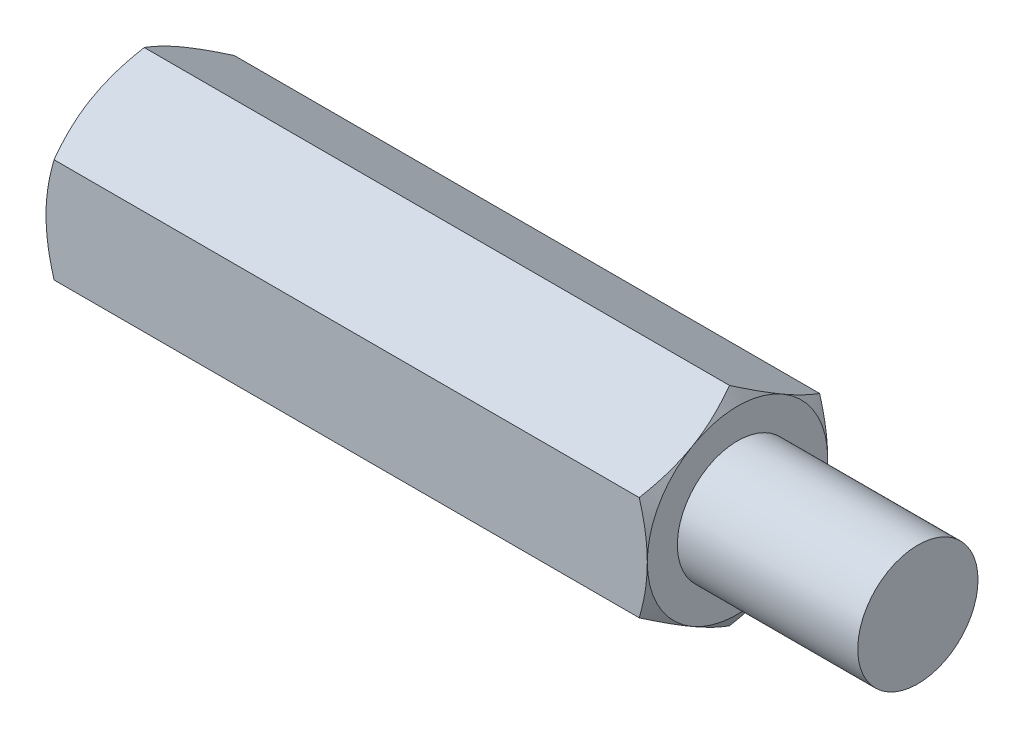
from build123d import *

# Parameters (mm, degrees)
SKETCH2_R          = 2
EXTRUDE1_DEPTH     = 9.5
CHAMFER1_SIZE      = 0.525
EXTRUDE4_DEPTH     = 20
SKETCH8_OUTSIDE_W  = 121.058
SKETCH8_OUTSIDE_H  = 121.986
SKETCH8_OUTSIDE_R  = 3
EXTRUDE5_DEPTH     = 30.853810477
EXTRUDE5_DRAFT     = -60
SKETCH9_OUTSIDE_W  = 88.72
SKETCH9_OUTSIDE_H  = 89.648
SKETCH9_OUTSIDE_R  = 3
EXTRUDE6_DEPTH     = 21.518284529
EXTRUDE6_DRAFT     = -60
EXTRUDE7_START     = -11.1
SKETCH10_R         = 2
EXTRUDE7_DEPTH     = 11.1
SWEEP3_PITCH       = 0.7
SKETCH13_R         = 2.0508
EXTRUDE8_DEPTH     = 30.853810487
SKETCH20_R         = 5
CUT_EXTRUDE6_DEPTH = 3.5


with BuildPart() as part:
    # Sketch2 → Extrude1 (new body)
    with BuildSketch(Plane(origin=(14.75, 0, 0), x_dir=(0, 0, -1), z_dir=(1, 0, 0))):
        Circle(SKETCH2_R)
    extrude(amount=-EXTRUDE1_DEPTH)

    # Chamfer1
    chamfer1_edges = [part.edges().sort_by_distance(p)[0] for p in [
        (14.75, 0, 2),
    ]]
    chamfer(chamfer1_edges, length=CHAMFER1_SIZE)

    # Sketch7 → Extrude4 (add)
    with BuildSketch(Plane(origin=(5.25, 0, 0), x_dir=(0, 0, -1), z_dir=(1, 0, 0))):
        Polygon((0, 3.464101615), (-3, 1.732050808), (-3, -1.732050808), (0, -3.464101615), (3, -1.732050808), (3, 1.732050808), align=None)
    extrude(amount=-EXTRUDE4_DEPTH)


with BuildPart() as extrude5_tool:
    # Sketch8 outside → Extrude5 (with draft: the straight prism first)
    with BuildSketch(Plane.ZY.offset(14.75)):
        Rectangle(SKETCH8_OUTSIDE_W, SKETCH8_OUTSIDE_H)
        Circle(SKETCH8_OUTSIDE_R, mode=Mode.SUBTRACT)
    extrude(amount=-EXTRUDE5_DEPTH)
    # Extrude5: the draft: its side faces are tilted about the plane it starts from
    extrude5_sides = [extrude5_tool.faces().sort_by_distance(p)[0] for p in [
        (0.676905239, -60.993, 0),
        (0.676905239, 0, 60.529),
        (0.676905239, 60.993, 0),
        (0.676905239, 0, -60.529),
        (0.676905239, 0, -3),
    ]]
    draft(extrude5_sides, Plane.ZY.offset(14.75), EXTRUDE5_DRAFT)


with BuildPart() as part_1:
    add(part.part)

    # Extrude5: cut by extrude5_tool
    add(extrude5_tool.part, mode=Mode.SUBTRACT)


with BuildPart() as extrude6_tool:
    # Sketch9 outside → Extrude6 (with draft: the straight prism first)
    with BuildSketch(Plane(origin=(5.25, 0, 0), x_dir=(0, 0, -1), z_dir=(1, 0, 0))):
        Rectangle(SKETCH9_OUTSIDE_W, SKETCH9_OUTSIDE_H)
        Circle(SKETCH9_OUTSIDE_R, mode=Mode.SUBTRACT)
    extrude(amount=-EXTRUDE6_DEPTH)
    # Extrude6: the draft: its side faces are tilted about the plane it starts from
    extrude6_sides = [extrude6_tool.faces().sort_by_distance(p)[0] for p in [
        (-5.509142264, -44.824, 0),
        (-5.509142264, 0, -44.36),
        (-5.509142264, 44.824, 0),
        (-5.509142264, 0, 44.36),
        (-5.509142264, 0, 3),
    ]]
    draft(extrude6_sides, Plane(origin=(5.25, 0, 0), x_dir=(0, 0, -1), z_dir=(1, 0, 0)), EXTRUDE6_DRAFT)


with BuildPart() as part_2:
    add(part_1.part)

    # Extrude6: cut by extrude6_tool
    add(extrude6_tool.part, mode=Mode.SUBTRACT)

    # Sketch10 → Extrude7 (cut)
    with BuildSketch(Plane.ZY.offset(14.75).offset(EXTRUDE7_START)):
        with Locations(Location((0, 0, 0), (0, 0, 180))):
            Circle(SKETCH10_R)
    extrude(amount=EXTRUDE7_DEPTH, mode=Mode.SUBTRACT)

    # Sweep3: the profile of Sketch12 profile screwed along a right-hand helix of 15.857143 turns, 6 arcs to a turn; built about Z, then put on its axis
    sweep3_z = Axis((0, 0, 0), (0, 0, 1))
    sweep3_corners = [(2.0003, 0, -0.612673205), (1.545336663, 0, -0.35), (1.545336663, 0, -0.2625), (2.0003, 0, 0.000173205)]
    with BuildLine(mode=Mode.PRIVATE) as sweep3_profile:
        Line(sweep3_corners[0], sweep3_corners[1])
        Line(sweep3_corners[1], sweep3_corners[2])
        Line(sweep3_corners[2], sweep3_corners[3])
        Line(sweep3_corners[3], sweep3_corners[0])
    sweep3_cap = Face(sweep3_profile.wire())
    sweep3_turn_angles = [0, 30, 60, 90, 120, 150, 180, 210, 240, 270, 300, 330, 360]
    sweep3_turn_weights = [1, 0.8660254037844387, 1, 0.8660254037844387, 1, 0.8660254037844387, 1, 0.8660254037844387, 1, 0.8660254037844387, 1, 0.8660254037844387, 1]
    sweep3_turn_rails = [Edge.make_bspline([Vector(p[0], p[1], 0).rotate(sweep3_z, sweep3_turn_angles[k]) / sweep3_turn_weights[k] + Vector(0, 0, p[2] + SWEEP3_PITCH * sweep3_turn_angles[k] / 360) for k in range(13)], [0, 0, 0, 1, 1, 2, 2, 3, 3, 4, 4, 5, 5, 6, 6, 6], 2, sweep3_turn_weights) for p in sweep3_corners]
    sweep3_turn_sides = [Face.make_surface_from_curves(sweep3_turn_rails[p[0]], sweep3_turn_rails[p[1]]) for p in [(0, 1), (1, 2), (2, 3), (3, 0)]]
    sweep3_last_angles = [5400, 5430, 5460, 5490, 5520, 5550, 5580, 5610, 5640, 5670, 5700, 5704.285714286, 5708.571428571]
    sweep3_last_weights = [1, 0.8660254037844387, 1, 0.8660254037844387, 1, 0.8660254037844387, 1, 0.8660254037844387, 1, 0.8660254037844387, 1, 0.9972037971811826, 1]
    sweep3_last_rails = [Edge.make_bspline([Vector(p[0], p[1], 0).rotate(sweep3_z, sweep3_last_angles[k]) / sweep3_last_weights[k] + Vector(0, 0, p[2] + SWEEP3_PITCH * sweep3_last_angles[k] / 360) for k in range(13)], [0, 0, 0, 1, 1, 2, 2, 3, 3, 4, 4, 5, 5, 6, 6, 6], 2, sweep3_last_weights) for p in sweep3_corners]
    sweep3_last_sides = [Face.make_surface_from_curves(sweep3_last_rails[p[0]], sweep3_last_rails[p[1]]) for p in [(0, 1), (1, 2), (2, 3), (3, 0)]]
    sweep3 = Plane(origin=(-14.75, 0, 0), x_dir=(0, 1, 0), z_dir=(1, 0, 0)) * Solid(Shell([*[p.moved(Location((0, 0, SWEEP3_PITCH * i))) for i in range(15) for p in sweep3_turn_sides], *sweep3_last_sides, sweep3_cap, sweep3_cap.rotate(sweep3_z, 5708.571428571).moved(Location((0, 0, SWEEP3_PITCH * 5708.571428571 / 360)))]))
    add(sweep3)

    # Sketch13 → Extrude8 (cut)
    with BuildSketch(Plane.ZY.offset(14.75)):
        Circle(SKETCH13_R)
    extrude(amount=EXTRUDE8_DEPTH, mode=Mode.SUBTRACT)

    # Extrude8 cone 1 section (through the dimple's axis) → Extrude8 other way (revolve, cut)
    with BuildSketch(Plane(origin=(-14.75, 0, 0), x_dir=(0, 0, 1), z_dir=(0, 1, 0))):
        Polygon((0, 0), (2.0508, 0), (0, 2.0508), align=None)
    revolve(axis=Axis((-14.75, 0, 0), (1, 0, 0)), mode=Mode.SUBTRACT)

    # Sketch20 → Cut-Extrude6 (cut)
    with BuildSketch(Plane(origin=(14.75, 0, 0), x_dir=(0, 0, -1), z_dir=(1, 0, 0))):
        Circle(SKETCH20_R)
    extrude(amount=-CUT_EXTRUDE6_DEPTH, mode=Mode.SUBTRACT)


solid = part_2.part
